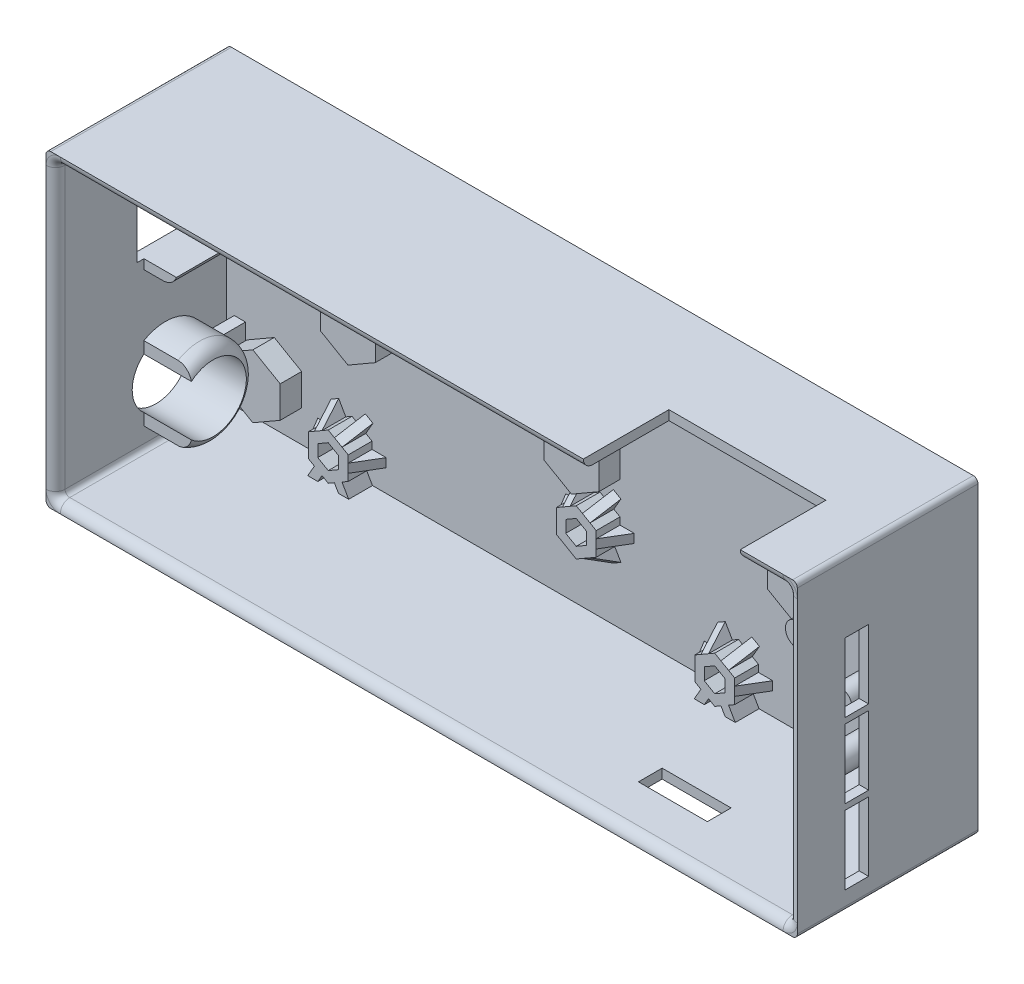
from build123d import *

# Parameters (mm, degrees)
ESBO_O1_W                   = 158
ESBO_O1_H                   = 65
RESSALTO_EXTRUS_O1_DEPTH    = 2
ESBO_O3_W                   = 158
ESBO_O3_H                   = 65
ESBO_O3_W_2                 = 154
ESBO_O3_H_2                 = 61
RESSALTO_EXTRUS_O2_DEPTH    = 32
ESBO_O9_W                   = 5
ESBO_O9_H                   = 14.5
CORTE_EXTRUS_O4_DEPTH       = 3
FILETE2_R                   = 1
ESBO_O28_W                  = 14.5
ESBO_O28_H                  = 5
CORTE_EXTRUS_O13_DEPTH      = 3
ESBO_O29_R                  = 2.5
RESSALTO_EXTRUS_O7_DEPTH    = 14
ESBO_O30_R                  = 7
ESBO_O30_W                  = 12
ESBO_O30_H                  = 14
CORTE_EXTRUS_O14_DEPTH      = 3
ESBO_O31_R                  = 9
ESBO_O31_R_2                = 7
RESSALTO_EXTRUS_O8_DEPTH    = 10
FILETE3_R                   = 3
ESBO_O32_W                  = 16
ESBO_O32_H                  = 18
ESBO_O32_W_2                = 12
ESBO_O32_H_2                = 14
RESSALTO_EXTRUS_O9_DEPTH    = 7
FILETE4_R                   = 3
ESBO_O33_W                  = 3
ESBO_O33_H                  = 14
CORTE_EXTRUS_O15_DEPTH      = 3
CORTE_EXTRUS_O16_DEPTH      = 47
CORTE_EXTRUS_O16_DEPTH_BACK = 3
ESBO_O34_W                  = 10
ESBO_O34_H                  = 3.5
CORTE_EXTRUS_O17_DEPTH      = 2
RESSALTO_EXTRUS_O10_DEPTH   = 4.5
CORTE_EXTRUS_O18_DEPTH      = 4.5
CORTE_EXTRUS_O18_DEPTH_BACK = 4.5
ESBO_O38_R                  = 3.987662124
ESBO_O38_R_2                = 4.299038484
ESBO_O38_R_3                = 4.020114398
ESBO_O38_R_4                = 3.841746328
ESBO_O38_R_5                = 4.701933519
ESBO_O38_R_6                = 4.523812843
ESBO_O38_R_7                = 4.213448947
RESSALTO_EXTRUS_O11_DEPTH   = 1
FILETE6_R                   = 0.5
RESSALTO_EXTRUS_O12_DEPTH   = 5
ESBO_O45_W                  = 3
ESBO_O45_H                  = 1.849742261
ESBO_O45_H_2                = 1.849742262
RESSALTO_EXTRUS_O13_DEPTH   = 5
CORTE_EXTRUS_O19_DEPTH      = 2
CORTE_EXTRUS_O20_DEPTH      = 2
CORTE_EXTRUS_O21_DEPTH      = 2
CORTE_EXTRUS_O22_DEPTH      = 2
CORTE_EXTRUS_O23_DEPTH      = 2
CORTE_EXTRUS_O24_DEPTH      = 2
CORTE_EXTRUS_O25_DEPTH      = 2
CORTE_EXTRUS_O26_DEPTH      = 2
CORTE_EXTRUS_O27_DEPTH      = 2
CORTE_EXTRUS_O28_DEPTH      = 2
CORTE_EXTRUS_O29_DEPTH      = 2
CORTE_EXTRUS_O30_DEPTH      = 2
CORTE_EXTRUS_O31_DEPTH      = 2
CORTE_EXTRUS_O32_DEPTH      = 1.9
CORTE_EXTRUS_O33_DEPTH      = 1.9
CORTE_EXTRUS_O34_DEPTH      = 1.9
CORTE_EXTRUS_O35_DEPTH      = 1.9
CORTE_EXTRUS_O36_DEPTH      = 1.9
CORTE_EXTRUS_O37_DEPTH      = 1.9
CORTE_EXTRUS_O38_DEPTH      = 1.9
CORTE_EXTRUS_O39_DEPTH      = 1.9
CORTE_EXTRUS_O40_DEPTH      = 1.9
CORTE_EXTRUS_O41_DEPTH      = 1.9
CORTE_EXTRUS_O42_DEPTH      = 1.9
CORTE_EXTRUS_O43_DEPTH      = 1.9
CORTE_EXTRUS_O44_DEPTH      = 1.9
RESSALTO_EXTRUS_O16_DEPTH   = 4
FILETE7_R                   = 2
ESBO_O78_W                  = 33
ESBO_O78_H                  = 18
CORTE_EXTRUS_O47_DEPTH      = 2
ESBO_O79_W                  = 1.267243041
ESBO_O79_H                  = 16.187236571
ESBO_O79_W_2                = 1.14769181
RESSALTO_EXTRUS_O17_DEPTH   = 4
ESBO_O80_W                  = 2.363247025
ESBO_O80_H                  = 10.146209854
RESSALTO_EXTRUS_O18_DEPTH   = 5.5


# Some blends are built 0.0001 mm under size
with BuildPart() as part:
    # Esboço1 → Ressalto-extrusão1 (new body)
    with BuildSketch(Plane.XY):
        with Locations((-79, 32.5)):
            Rectangle(ESBO_O1_W, ESBO_O1_H)
    extrude(amount=RESSALTO_EXTRUS_O1_DEPTH)

    # Esboço3 → Ressalto-extrusão2 (add)
    with BuildSketch(Plane.XY.offset(2)):
        with Locations((-79, 32.5)):
            Rectangle(ESBO_O3_W, ESBO_O3_H)
        with Locations((-79, 32.5)):
            Rectangle(ESBO_O3_W_2, ESBO_O3_H_2, mode=Mode.SUBTRACT)
    extrude(amount=RESSALTO_EXTRUS_O2_DEPTH)

    # Esboço9 → Corte-extrusão4 (cut)
    with BuildSketch(Plane(origin=(0, 0, 0), x_dir=(0, 0, -1), z_dir=(1, 0, 0))):
        with Locations((-25.5, 26.95)):
            Rectangle(ESBO_O9_W, ESBO_O9_H)
        with Locations((-25.5, 42.65)):
            Rectangle(ESBO_O9_W, ESBO_O9_H)
        with Locations((-25.5, 11.25)):
            Rectangle(ESBO_O9_W, ESBO_O9_H)
    extrude(amount=-CORTE_EXTRUS_O4_DEPTH, mode=Mode.SUBTRACT)

    # Filete2
    filete2_edges = [part.edges().sort_by_distance(p)[0] for p in [
        (-2, 63, 18),
        (-2, 2, 18),
        (-156, 2, 18),
        (-156, 63, 18),
        (0, 0, 17),
        (-158, 0, 17),
        (-158, 65, 17),
        (0, 65, 17),
    ]]
    fillet(filete2_edges, radius=FILETE2_R)

    # Esboço28 → Corte-extrusão13 (cut)
    with BuildSketch(Plane(origin=(0, 0, 0), x_dir=(-1, 0, 0), z_dir=(0, -1, 0))):
        with Locations((36.171903921, -25.5)):
            Rectangle(ESBO_O28_W, ESBO_O28_H)
    extrude(amount=-CORTE_EXTRUS_O13_DEPTH, mode=Mode.SUBTRACT)

    # Esboço29 → Ressalto-extrusão7 (add)
    with BuildSketch(Plane.XY.offset(2)):
        with Locations((-8, 57)):
            Circle(ESBO_O29_R)
        with Locations((-22, 33.5)):
            Circle(ESBO_O29_R)
        with Locations((-17.5, 11)):
            Circle(ESBO_O29_R)
        with Locations((-13, 26)):
            Circle(ESBO_O29_R)
        with Locations((-13, 41)):
            Circle(ESBO_O29_R)
    extrude(amount=RESSALTO_EXTRUS_O7_DEPTH)

    # Esboço30 → Corte-extrusão14 (cut)
    with BuildSketch(Plane.ZY.offset(158)):
        with Locations((14.870480003, 14.003310547)):
            Circle(ESBO_O30_R)
        with Locations((14.91, 43.700347018)):
            Rectangle(ESBO_O30_W, ESBO_O30_H)
    extrude(amount=-CORTE_EXTRUS_O14_DEPTH, mode=Mode.SUBTRACT)

    # Esboço31 → Ressalto-extrusão8 (add)
    with BuildSketch(Plane(origin=(-156, 0, 0), x_dir=(0, 0, -1), z_dir=(1, 0, 0))):
        with Locations(Location((-14.870480003, 14.003310547, 0), (0, 0, 180))):
            Circle(ESBO_O31_R)
        with Locations(Location((-14.870480003, 14.003310547, 0), (0, 0, 180))):
            Circle(ESBO_O31_R_2, mode=Mode.SUBTRACT)
    extrude(amount=RESSALTO_EXTRUS_O8_DEPTH)

    # Filete3
    # the kernel refuses this fillet: 3 mm, written as the material it takes off along each edge
    with BuildSketch(Plane(origin=(-146, 14.003310547, 14.870480003), x_dir=(0, 0, 1), z_dir=(0, 1, 0))) as filete3_piece_1:
        with BuildLine():
            CenterArc((6, -2.828427125), FILETE3_R, 0, 70.528779366)
            Line((7, 0), (7.02, 0.056568542))
            ThreePointArc((7.02, 0.056568542), (8, 0.06), (9, 0.06))
            Line((9, 0.06), (9.06, 0))
            Line((9.06, 0), (9.06, -2.828427125))
            Line((9.06, -2.828427125), (9, -2.828427125))
        make_face()
    revolve(axis=Axis((-146, 14.003310547, 14.870480003), (1, 0, 0)), mode=Mode.SUBTRACT)

    # Esboço32 → Ressalto-extrusão9 (add)
    with BuildSketch(Plane(origin=(-156, 0, 0), x_dir=(0, 0, -1), z_dir=(1, 0, 0))):
        with Locations((-14.91, 43.700347018)):
            Rectangle(ESBO_O32_W, ESBO_O32_H)
        with Locations((-14.91, 43.700347018)):
            Rectangle(ESBO_O32_W_2, ESBO_O32_H_2, mode=Mode.SUBTRACT)
    extrude(amount=RESSALTO_EXTRUS_O9_DEPTH)

    # Filete4
    # the kernel refuses this fillet: 3 mm, written as the material it takes off along each edge
    with BuildSketch(Plane(origin=(-149, 27.200347018, 6.91), x_dir=(0, 0, 1), z_dir=(0, 1, 0)), Plane(origin=(-149, 60.200347018, 22.91), x_dir=(0, 0, -1), z_dir=(0, -1, 0))) as filete4_piece_1:
        with BuildLine():
            CenterArc((FILETE4_R, -FILETE4_R), FILETE4_R, 90, 90)
            Line((0, -FILETE4_R), (0, 0))
            Line((0, 0), (FILETE4_R, 0))
        make_face()
    extrude(amount=33, mode=Mode.SUBTRACT)
    with BuildSketch(Plane(origin=(-149, 34.700347018, 30.41), x_dir=(0, 1, 0), z_dir=(0, 0, -1))) as filete4_piece_2_section:
        with BuildLine():
            CenterArc((FILETE4_R, -FILETE4_R), FILETE4_R, 90, 90)
            Line((0, -FILETE4_R), (0, 0))
            Line((0, 0), (FILETE4_R, 0))
        make_face()
    filete4_piece_2 = extrude(amount=31, mode=Mode.PRIVATE)
    filete4_piece_2 = split(filete4_piece_2, bisect_by=Plane(origin=(-149, 34.700347018, 2), z_dir=(0, 0, 1)), keep=Keep.TOP, mode=Mode.PRIVATE)
    add(filete4_piece_2, mode=Mode.SUBTRACT)
    with BuildSketch(Plane(origin=(-149, 52.700347018, -0.59), x_dir=(0, -1, 0), z_dir=(0, 0, 1))) as filete4_piece_3_section:
        with BuildLine():
            CenterArc((FILETE4_R, -FILETE4_R), FILETE4_R, 90, 90)
            Line((0, -FILETE4_R), (0, 0))
            Line((0, 0), (FILETE4_R, 0))
        make_face()
    filete4_piece_3 = extrude(amount=31, mode=Mode.PRIVATE)
    filete4_piece_3 = split(filete4_piece_3, bisect_by=Plane(origin=(-149, 52.700347018, 2), z_dir=(0, 0, 1)), keep=Keep.TOP, mode=Mode.PRIVATE)
    add(filete4_piece_3, mode=Mode.SUBTRACT)

    # Esboço33 → Corte-extrusão15 (cut)
    with BuildSketch(Plane(origin=(0, 0, 20.91), x_dir=(-1, 0, 0), z_dir=(0, 0, -1))):
        with Locations((150.671572875, 43.700347018)):
            Rectangle(ESBO_O33_W, ESBO_O33_H)
    extrude(amount=-CORTE_EXTRUS_O15_DEPTH, mode=Mode.SUBTRACT)

    # Esboço34 → Corte-extrusão16 (cut, two sides: drawn at the far end of the back side and taken through both)
    with BuildSketch(Plane.XZ.offset(-50.700347018).offset(-CORTE_EXTRUS_O16_DEPTH_BACK)):
        with Locations((-151, 21.16)):
            Rectangle(ESBO_O34_W, ESBO_O34_H)
    extrude(amount=CORTE_EXTRUS_O16_DEPTH + CORTE_EXTRUS_O16_DEPTH_BACK, mode=Mode.SUBTRACT)

    # Esboço35 → Corte-extrusão17 (cut)
    with BuildSketch(Plane(origin=(0, 0, 22.91), x_dir=(-1, 0, 0), z_dir=(0, 0, -1))):
        with BuildLine():
            Line((148.828427125, 9.957804619), (156, 9.957804619))
            Line((156, 9.957804619), (156, 18.048816476))
            Line((156, 18.048816476), (148.828427125, 18.048816476))
            add(Edge.make_bspline(
                [(148.828427125, 18.048816476), (148.721827144, 18.048816476), (148.617473443, 18.036268574), (148.412890024, 17.988135846), (148.311539299, 17.951862361), (148.025172375, 17.815144487), (147.852894626, 17.685148967), (147.408566467, 17.239032501), (147.197323117, 16.864378725), (146.964634039, 16.27710606), (146.900643282, 16.074532297), (146.795904993, 15.667894463), (146.754783321, 15.463001878), (146.658115832, 14.844588791), (146.628485083, 14.427442433), (146.628207302, 13.584897129), (146.657603619, 13.167368878), (146.753783178, 12.549007568), (146.794719575, 12.344171399), (146.898977131, 11.937737714), (146.96283246, 11.734810143), (147.117373485, 11.343295157), (147.207919423, 11.154063281), (147.425776621, 10.793671751), (147.554191951, 10.621822346), (147.850722242, 10.32321485), (148.023196697, 10.192743382), (148.309590824, 10.055529682), (148.411055092, 10.019022899), (148.616650565, 9.970441539), (148.721452308, 9.957804619), (148.828427125, 9.957804619)],
                knots=[0, 0, 0, 0, 0.03125, 0.03125, 0.0625, 0.0625, 0.125, 0.125, 0.25, 0.25, 0.3125, 0.3125, 0.375, 0.375, 0.5, 0.5, 0.625, 0.625, 0.6875, 0.6875, 0.75, 0.75, 0.8125, 0.8125, 0.875, 0.875, 0.9375, 0.9375, 0.96875, 0.96875, 1, 1, 1, 1], degree=3))
        make_face()
    extrude(amount=-CORTE_EXTRUS_O17_DEPTH, mode=Mode.SUBTRACT)


with BuildPart() as corte_extrus_o17_kept_piece:
    # of the separate pieces the step leaves, the one the design keeps (corte_extrus_o17_pieces_kept)
    add(part.part.solids().sort_by_distance((-157, 0, 34))[0])

    # Esboço36 → Ressalto-extrusão10 (add)
    # profile 1 of 7: a face of its own
    with BuildSketch(Plane.XY.offset(2)):
        Polygon((-151.75, 58.319764048), (-151.75, 51.680235952), (-146, 48.360471904), (-140.25, 51.680235952), (-140.25, 58.319764048), (-146, 61.639528096), align=None)
        Polygon((-148.75, 53.41228676), (-146, 51.824573519), (-143.25, 53.41228676), (-143.25, 56.58771324), (-146, 58.175426481), (-148.75, 56.58771324), align=None, mode=Mode.SUBTRACT)
    # profile 2 of 7: a face of its own
    with BuildSketch(Plane.XY.offset(2)):
        Polygon((-120.25, 29.180235952), (-120.25, 35.819764048), (-126, 39.139528096), (-131.75, 35.819764048), (-131.75, 29.180235952), (-126, 25.860471904), align=None)
        Polygon((-123.25, 34.08771324), (-126, 35.675426481), (-128.75, 34.08771324), (-128.75, 30.91228676), (-126, 29.324573519), (-123.25, 30.91228676), align=None, mode=Mode.SUBTRACT)
    # profile 3 of 7: a face of its own
    with BuildSketch(Plane.XY.offset(2)):
        Polygon((-140.25, 8.680235952), (-140.25, 15.319764048), (-146, 18.639528096), (-151.75, 15.319764048), (-151.75, 8.680235952), (-146, 5.360471904), align=None)
        Polygon((-143.25, 13.58771324), (-146, 15.175426481), (-148.75, 13.58771324), (-148.75, 10.41228676), (-146, 8.824573519), (-143.25, 10.41228676), align=None, mode=Mode.SUBTRACT)
    # profile 4 of 7: a face of its own
    with BuildSketch(Plane.XY.offset(2)):
        Polygon((-73.25, 29.180235952), (-73.25, 35.819764048), (-79, 39.139528096), (-84.75, 35.819764048), (-84.75, 29.180235952), (-79, 25.860471904), align=None)
        Polygon((-76.25, 34.08771324), (-79, 35.675426481), (-81.75, 34.08771324), (-81.75, 30.91228676), (-79, 29.324573519), (-76.25, 30.91228676), align=None, mode=Mode.SUBTRACT)
    # profile 5 of 7: a face of its own
    with BuildSketch(Plane.XY.offset(2)):
        Polygon((-26.25, 29.180235952), (-26.25, 35.819764048), (-32, 39.139528096), (-37.75, 35.819764048), (-37.75, 29.180235952), (-32, 25.860471904), align=None)
        Polygon((-29.25, 34.08771324), (-32, 35.675426481), (-34.75, 34.08771324), (-34.75, 30.91228676), (-32, 29.324573519), (-29.25, 30.91228676), align=None, mode=Mode.SUBTRACT)
    # profile 6 of 7: a face of its own
    with BuildSketch(Plane.XY.offset(2)):
        Polygon((-17.75, 56.319764048), (-17.75, 49.680235952), (-12, 46.360471904), (-6.25, 49.680235952), (-6.25, 56.319764048), (-12, 59.639528096), align=None)
        Polygon((-14.75, 51.41228676), (-12, 49.824573519), (-9.25, 51.41228676), (-9.25, 54.58771324), (-12, 56.175426481), (-14.75, 54.58771324), align=None, mode=Mode.SUBTRACT)
    # profile 7 of 7: a face of its own
    with BuildSketch(Plane.XY.offset(2)):
        Polygon((-6.25, 8.680235952), (-6.25, 15.319764048), (-12, 18.639528096), (-17.75, 15.319764048), (-17.75, 8.680235952), (-12, 5.360471904), align=None)
        Polygon((-9.25, 13.58771324), (-12, 15.175426481), (-14.75, 13.58771324), (-14.75, 10.41228676), (-12, 8.824573519), (-9.25, 10.41228676), align=None, mode=Mode.SUBTRACT)
    extrude(amount=RESSALTO_EXTRUS_O10_DEPTH)

    # Esboço37 → Corte-extrusão18 (cut, two sides: drawn at the far end of the back side and taken through both)
    with BuildSketch(Plane.XY.offset(2).offset(-CORTE_EXTRUS_O18_DEPTH_BACK)):
        Polygon((-29.249864749, 34.087938134), (-31.999864749, 35.675651375), (-34.749864749, 34.087938134), (-34.749864749, 30.912511654), (-31.999864749, 29.324798414), (-29.249864749, 30.912511654), align=None)
        Polygon((-123.25, 34.08771324), (-126, 35.675426481), (-128.75, 34.08771324), (-128.75, 30.91228676), (-126, 29.324573519), (-123.25, 30.91228676), align=None)
        Polygon((-148.75, 53.41228676), (-146, 51.824573519), (-143.25, 53.41228676), (-143.25, 56.58771324), (-146, 58.175426481), (-148.75, 56.58771324), align=None)
        Polygon((-143.25, 13.58771324), (-146, 15.175426481), (-148.75, 13.58771324), (-148.75, 10.41228676), (-146, 8.824573519), (-143.25, 10.41228676), align=None)
        Polygon((-76.25, 34.08771324), (-79, 35.675426481), (-81.75, 34.08771324), (-81.75, 30.91228676), (-79, 29.324573519), (-76.25, 30.91228676), align=None)
        Polygon((-14.75, 51.41228676), (-12, 49.824573519), (-9.25, 51.41228676), (-9.25, 54.58771324), (-12, 56.175426481), (-14.75, 54.58771324), align=None)
        Polygon((-9.249902839, 13.587659255), (-11.999902839, 15.175372496), (-14.749902839, 13.587659255), (-14.749902839, 10.412232775), (-11.999902839, 8.824519535), (-9.249902839, 10.412232775), align=None)
    extrude(amount=CORTE_EXTRUS_O18_DEPTH + CORTE_EXTRUS_O18_DEPTH_BACK, mode=Mode.SUBTRACT)

    # Esboço38 → Ressalto-extrusão11 (add)
    with BuildSketch(Plane.XY.offset(6.5)):
        with Locations((-79.176275835, 32.598510192)):
            Circle(ESBO_O38_R)
        with Locations((-126.155236386, 32.598510192)):
            Circle(ESBO_O38_R_2)
        with Locations((-145.998279379, 55.119394969)):
            Circle(ESBO_O38_R_3)
        with Locations((-145.998279379, 11.890437993)):
            Circle(ESBO_O38_R_4)
        with Locations((-11.958357515, 11.890437993)):
            Circle(ESBO_O38_R_5)
        with Locations((-31.837089943, 32.598510192)):
            Circle(ESBO_O38_R_6)
        with Locations((-11.958357515, 53.366898853)):
            Circle(ESBO_O38_R_7)
    extrude(amount=-RESSALTO_EXTRUS_O11_DEPTH)

    # Filete6
    # the kernel refuses this fillet: 0.5 mm, written as the material it adds along each edge
    with BuildSketch(Plane(origin=(-149.832531755, 54.03728676, 5.5), x_dir=(0, 0, -1), z_dir=(0.8660254037844398, -0.49999999999999795, 0)), Plane(origin=(-75.167468245, 33.46271324, 5.5), x_dir=(0, 0, -1), z_dir=(-0.8660254037844389, 0.49999999999999967, 0)), Plane(origin=(-142.167468245, 12.96271324, 5.5), x_dir=(0, 0, -1), z_dir=(-0.8660254037844387, 0.5, 0)), Plane(origin=(-122.167468245, 33.46271324, 5.5), x_dir=(0, 0, -1), z_dir=(-0.8660254037844347, 0.500000000000007, 0)), Plane(origin=(-8.167371085, 12.962659255, 5.5), x_dir=(0, 0, -1), z_dir=(-0.8660254037844384, 0.5000000000000004, 0)), Plane(origin=(-15.832531755, 52.03728676, 5.5), x_dir=(0, 0, -1), z_dir=(0.8660254037844389, -0.49999999999999967, 0)), Plane(origin=(-28.167332995, 33.462938134, 5.5), x_dir=(0, 0, -1), z_dir=(-0.8660254037844382, 0.5000000000000009, 0))) as filete6_piece_1:
        with BuildLine():
            CenterArc((FILETE6_R, FILETE6_R), FILETE6_R, 180, 90)
            Line((0, FILETE6_R), (0, 0))
            Line((0, 0), (FILETE6_R, 0))
        make_face()
    extrude(amount=5.675426481)
    with BuildSketch(Plane(origin=(-147.082531755, 51.199573519, 5.5), x_dir=(-0.4999999999999986, 0.8660254037844395, 0), z_dir=(0.8660254037844395, 0.4999999999999986, 0)), Plane(origin=(-143.25, 52.16228676, 5.5), x_dir=(-1, 0, 0), z_dir=(0, 1, 0)), Plane(origin=(-142.167468245, 55.96271324, 5.5), x_dir=(-0.5000000000000013, -0.8660254037844379, 0), z_dir=(-0.8660254037844379, 0.5000000000000013, 0)), Plane(origin=(-144.917468245, 58.800426481, 5.5), x_dir=(0.4999999999999991, -0.8660254037844392, 0), z_dir=(-0.8660254037844393, -0.49999999999999917, 0)), Plane(origin=(-148.75, 57.83771324, 5.5), x_dir=(1, 0, 0), z_dir=(0, -1, 0)), Plane(origin=(-77.917468245, 36.300426481, 5.5), x_dir=(0.49999999999999967, -0.8660254037844389, 0), z_dir=(-0.8660254037844389, -0.49999999999999967, 0)), Plane(origin=(-76.25, 29.66228676, 5.5), x_dir=(-1, 0, 0), z_dir=(0, 1, 0)), Plane(origin=(-80.082531755, 28.699573519, 5.5), x_dir=(-0.5000000000000023, 0.8660254037844374, 0), z_dir=(0.8660254037844374, 0.5000000000000022, 0)), Plane(origin=(-82.832531755, 31.53728676, 5.5), x_dir=(0.5000000000000013, 0.8660254037844379, 0), z_dir=(0.8660254037844379, -0.5000000000000013, 0)), Plane(origin=(-81.75, 35.33771324, 5.5), x_dir=(1, 0, 0), z_dir=(0, -1, 0)), Plane(origin=(-149.832531755, 11.03728676, 5.5), x_dir=(0.5000000000000079, 0.8660254037844342, 0), z_dir=(0.8660254037844342, -0.5000000000000079, 0)), Plane(origin=(-148.75, 14.83771324, 5.5), x_dir=(1, 0, 0), z_dir=(0, -1, 0)), Plane(origin=(-144.917468245, 15.800426481, 5.5), x_dir=(0.500000000000001, -0.8660254037844382, 0), z_dir=(-0.8660254037844382, -0.500000000000001, 0)), Plane(origin=(-143.25, 9.16228676, 5.5), x_dir=(-1, 0, 0), z_dir=(0, 1, 0)), Plane(origin=(-147.082531755, 8.199573519, 5.5), x_dir=(-0.4999999999999944, 0.8660254037844419, 0), z_dir=(0.8660254037844419, 0.49999999999999434, 0)), Plane(origin=(-129.832531755, 31.53728676, 5.5), x_dir=(0.5000000000000051, 0.8660254037844357, 0), z_dir=(0.8660254037844358, -0.5000000000000051, 0)), Plane(origin=(-127.082531755, 28.699573519, 5.5), x_dir=(-0.5000000000000044, 0.8660254037844362, 0), z_dir=(0.8660254037844362, 0.5000000000000043, 0)), Plane(origin=(-123.25, 29.66228676, 5.5), x_dir=(-1, 0, 0), z_dir=(0, 1, 0)), Plane(origin=(-128.75, 35.33771324, 5.5), x_dir=(1, 0, 0), z_dir=(0, -1, 0)), Plane(origin=(-124.917468245, 36.300426481, 5.5), x_dir=(0.4999999999999991, -0.8660254037844392, 0), z_dir=(-0.8660254037844393, -0.49999999999999917, 0)), Plane(origin=(-13.082434594, 8.199519535, 5.5), x_dir=(-0.4999999999999998, 0.8660254037844388, 0), z_dir=(0.8660254037844388, 0.4999999999999998, 0)), Plane(origin=(-15.832531755, 11.03728676, 5.5), x_dir=(0.4999999999999994, 0.866025403784439, 0), z_dir=(0.866025403784439, -0.49999999999999944, 0)), Plane(origin=(-9.249902839, 9.162232775, 5.5), x_dir=(-1, 0, 0), z_dir=(0, 1, 0)), Plane(origin=(-10.917468245, 15.800426481, 5.5), x_dir=(0.4999999999999999, -0.8660254037844387, 0), z_dir=(-0.8660254037844388, -0.49999999999999994, 0)), Plane(origin=(-14.75, 14.83771324, 5.5), x_dir=(1, 0, 0), z_dir=(0, -1, 0)), Plane(origin=(-13.082531755, 49.199573519, 5.5), x_dir=(-0.5000000000000001, 0.8660254037844386, 0), z_dir=(0.8660254037844386, 0.5000000000000001, 0)), Plane(origin=(-9.25, 50.16228676, 5.5), x_dir=(-1, 0, 0), z_dir=(0, 1, 0)), Plane(origin=(-8.167468245, 53.96271324, 5.5), x_dir=(-0.49999999999999895, -0.8660254037844393, 0), z_dir=(-0.8660254037844393, 0.49999999999999895, 0)), Plane(origin=(-14.75, 55.83771324, 5.5), x_dir=(1, 0, 0), z_dir=(0, -1, 0)), Plane(origin=(-10.917468245, 56.800426481, 5.5), x_dir=(0.49999999999999767, -0.86602540378444, 0), z_dir=(-0.86602540378444, -0.4999999999999977, 0)), Plane(origin=(-34.75, 35.33771324, 5.5), x_dir=(1, 0, 0), z_dir=(0, -1, 0)), Plane(origin=(-30.917332995, 36.300651375, 5.5), x_dir=(0.5000000000000009, -0.8660254037844382, 0), z_dir=(-0.8660254037844382, -0.5000000000000009, 0)), Plane(origin=(-29.249864749, 29.662511654, 5.5), x_dir=(-1, 0, 0), z_dir=(0, 1, 0)), Plane(origin=(-33.082531755, 28.699573519, 5.5), x_dir=(-0.4999999999999987, 0.8660254037844394, 0), z_dir=(0.8660254037844395, 0.4999999999999987, 0)), Plane(origin=(-35.832531755, 31.53728676, 5.5), x_dir=(0.499999999999999, 0.8660254037844393, 0), z_dir=(0.8660254037844393, -0.49999999999999895, 0))) as filete6_piece_2:
        with BuildLine():
            CenterArc((FILETE6_R, -FILETE6_R), FILETE6_R, 90, 90)
            Line((0, -FILETE6_R), (0, 0))
            Line((0, 0), (FILETE6_R, 0))
        make_face()
    extrude(amount=5.675426481)

    # Esboço44 → Ressalto-extrusão12 (add)
    # profile 1 of 5: a face of its own
    with BuildSketch(Plane.XY.offset(2)):
        Polygon((-129.646690539, 60.726280189), (-133.846690539, 58.301409058), (-133.846690539, 53.451666797), (-129.646690539, 51.026795666), (-125.446690539, 53.451666797), (-125.446690539, 58.301409058), align=None)
        Polygon((-129.646690539, 58.416879112), (-131.846690539, 57.14670852), (-131.846690539, 54.606367335), (-129.646690539, 53.336196743), (-127.446690539, 54.606367335), (-127.446690539, 57.14670852), align=None, mode=Mode.SUBTRACT)
    # profile 2 of 5: a face of its own
    with BuildSketch(Plane.XY.offset(2)):
        Polygon((-129.646690539, 12.466280189), (-133.846690539, 10.041409058), (-133.846690539, 5.191666797), (-129.646690539, 2.766795666), (-125.446690539, 5.191666797), (-125.446690539, 10.041409058), align=None)
        Polygon((-129.646690539, 10.156879112), (-131.846690539, 8.88670852), (-131.846690539, 6.346367335), (-129.646690539, 5.076196743), (-127.446690539, 6.346367335), (-127.446690539, 8.88670852), align=None, mode=Mode.SUBTRACT)
    # profile 3 of 5: a face of its own
    with BuildSketch(Plane.XY.offset(2)):
        Polygon((-77.491824846, 24.749742261), (-81.691824846, 22.324871131), (-81.691824846, 17.475128869), (-77.491824846, 15.050257739), (-73.291824846, 17.475128869), (-73.291824846, 22.324871131), align=None)
        Polygon((-77.491824846, 22.440341184), (-79.691824846, 21.170170592), (-79.691824846, 18.629829408), (-77.491824846, 17.359658816), (-75.291824846, 18.629829408), (-75.291824846, 21.170170592), align=None, mode=Mode.SUBTRACT)
    # profile 4 of 5: a face of its own
    with BuildSketch(Plane.XY.offset(2)):
        Polygon((-48.366690539, 12.466280189), (-52.566690539, 10.041409058), (-52.566690539, 5.191666797), (-48.366690539, 2.766795666), (-44.166690539, 5.191666797), (-44.166690539, 10.041409058), align=None)
        Polygon((-48.366690539, 10.156879112), (-50.566690539, 8.88670852), (-50.566690539, 6.346367335), (-48.366690539, 5.076196743), (-46.166690539, 6.346367335), (-46.166690539, 8.88670852), align=None, mode=Mode.SUBTRACT)
    # profile 5 of 5: a face of its own
    with BuildSketch(Plane.XY.offset(2)):
        Polygon((-53.446690539, 60.726280189), (-57.646690539, 58.301409058), (-57.646690539, 53.451666797), (-53.446690539, 51.026795666), (-49.246690539, 53.451666797), (-49.246690539, 58.301409058), align=None)
        Polygon((-53.446690539, 58.416879112), (-55.646690539, 57.14670852), (-55.646690539, 54.606367335), (-53.446690539, 53.336196743), (-51.246690539, 54.606367335), (-51.246690539, 57.14670852), align=None, mode=Mode.SUBTRACT)
    extrude(amount=RESSALTO_EXTRUS_O12_DEPTH)

    # Esboço45 → Ressalto-extrusão13 (add)
    with BuildSketch(Plane.XY.offset(2)):
        with Locations((-123.946690539, 55.876537928)):
            Rectangle(ESBO_O45_W, ESBO_O45_H)
        Polygon((-132.445728644, 62.5743564), (-130.945728644, 59.976280189), (-132.547652433, 59.051409058), (-134.047652433, 61.649485269), align=None)
        with Locations((-135.346690539, 55.876537928)):
            Rectangle(ESBO_O45_W, ESBO_O45_H)
        Polygon((-134.047652433, 50.103590585), (-132.547652433, 52.701666797), (-130.945728644, 51.776795666), (-132.445728644, 49.178719455), align=None)
        Polygon((-126.847652433, 49.178719455), (-128.347652433, 51.776795666), (-126.745728644, 52.701666797), (-125.245728644, 50.103590585), align=None)
        Polygon((-125.245728644, 61.649485269), (-126.847652433, 62.5743564), (-128.347652433, 59.976280189), (-126.745728644, 59.051409058), align=None)
        Polygon((-127.47975753, 2), (-128.353523045, 3.513406267), (-126.751599257, 4.438277397), (-125.343859145, 2), align=None)
        Polygon((-133.959748782, 1.992239999), (-132.546091779, 4.440765753), (-130.94416799, 3.515894622), (-131.819370159, 2), align=None)
        with Locations((-135.346690539, 7.607957041)):
            Rectangle(ESBO_O45_W, ESBO_O45_H)
        Polygon((-132.451599257, 14.310967), (-130.951599257, 11.712890789), (-132.553523045, 10.788019658), (-134.053523045, 13.38609587), align=None)
        Polygon((-125.24416799, 13.388584225), (-126.846091779, 14.313455356), (-128.346091779, 11.715379145), (-126.74416799, 10.790508014), align=None)
        with Locations((-123.946690539, 7.607957041)):
            Rectangle(ESBO_O45_W, ESBO_O45_H)
        with Locations((-71.791824846, 19.899872626)):
            Rectangle(ESBO_O45_W, ESBO_O45_H)
        Polygon((-73.09061855, 25.672806236), (-74.692542339, 26.597677367), (-76.192542339, 23.999601156), (-74.59061855, 23.074730025), align=None)
        Polygon((-80.290728859, 26.597895891), (-78.790728859, 23.99981968), (-80.392652648, 23.074948549), (-81.892652648, 25.67302476), align=None)
        with Locations((-83.191824846, 19.899872626)):
            Rectangle(ESBO_O45_W, ESBO_O45_H)
        Polygon((-81.892542339, 14.126911553), (-80.392542339, 16.724987764), (-78.79061855, 15.800116633), (-80.29061855, 13.202040422), align=None)
        Polygon((-74.692652648, 13.202258946), (-76.192652648, 15.800335157), (-74.590728859, 16.725206288), (-73.090728859, 14.127130076), align=None)
        with Locations((-42.666690539, 7.625326922)):
            Rectangle(ESBO_O45_W, ESBO_O45_H)
        Polygon((-43.964696875, 13.388889577), (-45.566620663, 14.313760707), (-47.066620663, 11.715684496), (-45.464696875, 10.790813365), align=None)
        Polygon((-51.157085382, 14.31934659), (-49.657085382, 11.721270378), (-51.259009171, 10.796399248), (-52.759009171, 13.394475459), align=None)
        with Locations((-54.066690539, 7.625326922)):
            Rectangle(ESBO_O45_W, ESBO_O45_H)
        Polygon((-52.680453961, 1.992239999), (-51.266620663, 4.441071104), (-49.664696875, 3.516199974), (-50.540075337, 2), align=None)
        Polygon((-46.180405697, 2), (-47.059009171, 3.521785856), (-45.457085382, 4.446656987), (-44.044507312, 2), align=None)
        Polygon((-49.045419826, 61.649306973), (-49.602599669, 61.970994905), (-50.995591597, 61.970994905), (-52.147343615, 59.976101892), (-50.545419826, 59.051230762), align=None)
        Polygon((-55.897172755, 61.970994905), (-54.745574918, 59.976368943), (-56.347498707, 59.051497812), (-57.847498707, 61.649574023), (-57.290781408, 61.970994905), align=None)
        with Locations((-59.146690539, 55.876358843)):
            Rectangle(ESBO_O45_W, ESBO_O45_H_2)
        Polygon((-57.847343615, 50.103412289), (-56.347343615, 52.701488501), (-54.745419826, 51.77661737), (-56.245419826, 49.178541159), align=None)
        Polygon((-50.647498707, 49.178808209), (-52.147498707, 51.77688442), (-50.545574918, 52.701755551), (-49.045574918, 50.103679339), align=None)
        with Locations((-47.746690539, 55.876358843)):
            Rectangle(ESBO_O45_W, ESBO_O45_H_2)
    extrude(amount=RESSALTO_EXTRUS_O13_DEPTH)

    # Esboço47 → Corte-extrusão19 (cut)
    with BuildSketch(Plane.XZ.offset(-54.951666797)):
        Polygon((-125.446690539, 7), (-122.446690539, 2), (-122.446690539, 7), align=None)
    extrude(amount=-CORTE_EXTRUS_O19_DEPTH, mode=Mode.SUBTRACT)

    # Esboço48 → Corte-extrusão20 (cut)
    with BuildSketch(Plane(origin=(-73.840729138, -42.631964845, 0), x_dir=(0, 0, 1), z_dir=(-0.8660254037844383, -0.5000000000000007, 0))):
        Polygon((7, 109.01384659), (2, 106.01384659), (7, 106.01384659), align=None)
    extrude(amount=-CORTE_EXTRUS_O20_DEPTH, mode=Mode.SUBTRACT)

    # Esboço49 → Corte-extrusão21 (cut)
    with BuildSketch(Plane(origin=(-120.62930667, 69.645362678, 0), x_dir=(0, 0, -1), z_dir=(0.866025403784437, -0.5000000000000028, 0))):
        Polygon((-7, -20.632843949), (-2, -23.632843949), (-7, -23.632843949), align=None)
    extrude(amount=-CORTE_EXTRUS_O21_DEPTH, mode=Mode.SUBTRACT)

    # Esboço50 → Corte-extrusão22 (cut)
    with BuildSketch(Plane.XZ.offset(-54.951666797)):
        Polygon((-133.846690539, 7), (-136.846690539, 2), (-136.846690539, 7), align=None)
    extrude(amount=-CORTE_EXTRUS_O22_DEPTH, mode=Mode.SUBTRACT)

    # Esboço51 → Corte-extrusão23 (cut)
    with BuildSketch(Plane(origin=(-73.840729138, -42.631964845, 0), x_dir=(0, 0, 1), z_dir=(-0.8660254037844383, -0.5000000000000007, 0))):
        Polygon((7, 117.41384659), (2, 120.41384659), (7, 120.41384659), align=None)
    extrude(amount=-CORTE_EXTRUS_O23_DEPTH, mode=Mode.SUBTRACT)

    # Esboço52 → Corte-extrusão24 (cut)
    with BuildSketch(Plane(origin=(-120.62930667, 69.645362678, 0), x_dir=(0, 0, -1), z_dir=(0.8660254037844383, -0.5000000000000007, 0))):
        Polygon((-7, -12.195323525), (-2, -9.232843949), (-7, -9.232843949), align=None)
    extrude(amount=-CORTE_EXTRUS_O24_DEPTH, mode=Mode.SUBTRACT)

    # Esboço53 → Corte-extrusão25 (cut)
    with BuildSketch(Plane.XZ.offset(-54.951487712)):
        Polygon((-49.246690539, 7), (-46.246690539, 2), (-46.246690539, 7), align=None)
    extrude(amount=-CORTE_EXTRUS_O25_DEPTH, mode=Mode.SUBTRACT)

    # Esboço54 → Corte-extrusão26 (cut)
    with BuildSketch(Plane(origin=(-16.690575412, -9.636308207, 0), x_dir=(0, 0, 1), z_dir=(-0.8660254037844374, -0.5000000000000022, 0))):
        Polygon((7, 70.91384659), (2, 67.91384659), (7, 67.91384659), align=None)
    extrude(amount=-CORTE_EXTRUS_O26_DEPTH, mode=Mode.SUBTRACT)

    # Esboço55 → Corte-extrusão27 (cut)
    with BuildSketch(Plane.XZ.offset(-54.951487712)):
        Polygon((-57.646690539, 7), (-60.646690539, 2), (-60.646690539, 7), align=None)
    extrude(amount=-CORTE_EXTRUS_O27_DEPTH, mode=Mode.SUBTRACT)

    # Esboço56 → Corte-extrusão28 (cut)
    with BuildSketch(Plane(origin=(-16.690575412, -9.636308207, 0), x_dir=(0, 0, 1), z_dir=(-0.8660254037844383, -0.5000000000000007, 0))):
        Polygon((7, 79.31384659), (2, 82.31384659), (7, 82.31384659), align=None)
    extrude(amount=-CORTE_EXTRUS_O28_DEPTH, mode=Mode.SUBTRACT)

    # Esboço57 → Corte-extrusão29 (cut)
    with BuildSketch(Plane(origin=(-63.478997852, 36.649616498, 0), x_dir=(0, 0, -1), z_dir=(0.8660254037844374, -0.5000000000000024, 0))):
        Polygon((-7, 25.867156051), (-2, 28.867156051), (-7, 28.867156051), align=None)
    extrude(amount=-CORTE_EXTRUS_O29_DEPTH, mode=Mode.SUBTRACT)

    # Esboço58 → Corte-extrusão30 (cut)
    with BuildSketch(Plane(origin=(-63.478997852, 36.649616498, 0), x_dir=(0, 0, -1), z_dir=(0.86602540378444, -0.49999999999999784, 0))):
        Polygon((-7, 17.467156051), (-2, 14.467156051), (-7, 14.467156051), align=None)
    extrude(amount=-CORTE_EXTRUS_O30_DEPTH, mode=Mode.SUBTRACT)

    # Esboço59 → Corte-extrusão31 (cut)
    with BuildSketch(Plane(origin=(-65.934615106, 38.06736778, 0), x_dir=(0, 0, -1), z_dir=(0.8660254037844383, -0.5000000000000007, 0))):
        Polygon((-7, -17.312006888), (-2, -14.312006888), (-7, -14.312006888), align=None)
    extrude(amount=-CORTE_EXTRUS_O31_DEPTH, mode=Mode.SUBTRACT)

    # Esboço61 → Corte-extrusão32 (cut)
    with BuildSketch(Plane(origin=(-50.302743669, -29.042302598, 0), x_dir=(0, 0, 1), z_dir=(-0.8660254037844383, -0.5000000000000007, 0))):
        Polygon((7, 60.179817958), (2, 63.179817958), (7, 63.179817958), align=None)
    extrude(amount=-CORTE_EXTRUS_O32_DEPTH, mode=Mode.SUBTRACT)

    # Esboço62 → Corte-extrusão33 (cut)
    with BuildSketch(Plane(origin=(0, 20.824743756, 0), x_dir=(1, 0, 0), z_dir=(0, 1, 0))):
        Polygon((-81.691824846, -7), (-84.691824846, -7), (-84.691824846, -2), align=None)
    extrude(amount=-CORTE_EXTRUS_O33_DEPTH, mode=Mode.SUBTRACT)

    # Esboço63 → Corte-extrusão34 (cut)
    with BuildSketch(Plane(origin=(0, 20.824743756, 0), x_dir=(1, 0, 0), z_dir=(0, 1, 0))):
        Polygon((-73.291824846, -7), (-70.291824846, -2), (-70.291824846, -7), align=None)
    extrude(amount=-CORTE_EXTRUS_O34_DEPTH, mode=Mode.SUBTRACT)

    # Esboço64 → Corte-extrusão35 (cut)
    with BuildSketch(Plane(origin=(-48.70081988, -28.117431468, 0), x_dir=(0, 0, -1), z_dir=(0.8660254037844383, 0.5000000000000007, 0))):
        Polygon((-7, 51.779817958), (-2, 48.779817958), (-7, 48.779817958), align=None)
    extrude(amount=-CORTE_EXTRUS_O35_DEPTH, mode=Mode.SUBTRACT)

    # Esboço65 → Corte-extrusão36 (cut)
    with BuildSketch(Plane(origin=(-65.934615106, 38.06736778, 0), x_dir=(0, 0, -1), z_dir=(0.8660254037844386, -0.5, 0))):
        Polygon((-7, -25.712006888), (-2, -28.712006888), (-7, -28.712006888), align=None)
    extrude(amount=-CORTE_EXTRUS_O36_DEPTH, mode=Mode.SUBTRACT)

    # Esboço66 → Corte-extrusão37 (cut)
    with BuildSketch(Plane(origin=(-99.730553023, 57.579461634, 0), x_dir=(0, 0, -1), z_dir=(0.8660254037844385, -0.5000000000000004, 0))):
        Polygon((-7, -54.027229935), (-2, -51.027229935), (-7, -51.027229935), align=None)
    extrude(amount=-CORTE_EXTRUS_O37_DEPTH, mode=Mode.SUBTRACT)

    # Esboço67 → Corte-extrusão38 (cut)
    with BuildSketch(Plane(origin=(-93.141868955, -53.775483114, 0), x_dir=(0, 0, -1), z_dir=(0.8660254037844382, 0.5000000000000009, 0))):
        Polygon((-7, 75.619460603), (-2, 78.619460603), (-7, 78.619460603), align=None)
    extrude(amount=-CORTE_EXTRUS_O38_DEPTH, mode=Mode.SUBTRACT)

    # Esboço68 → Corte-extrusão39 (cut)
    with BuildSketch(Plane(origin=(0, 8.532828171, 0), x_dir=(1, 0, 0), z_dir=(0, 1, 0))):
        Polygon((-125.446690539, -7), (-122.446690539, -2), (-122.446690539, -7), align=None)
    extrude(amount=-CORTE_EXTRUS_O39_DEPTH, mode=Mode.SUBTRACT)

    # Esboço69 → Corte-extrusão40 (cut)
    with BuildSketch(Plane(origin=(0, 8.532828171, 0), x_dir=(1, 0, 0), z_dir=(0, 1, 0))):
        Polygon((-133.846690539, -7), (-136.846690539, -2), (-136.846690539, -7), align=None)
    extrude(amount=-CORTE_EXTRUS_O40_DEPTH, mode=Mode.SUBTRACT)

    # Esboço70 → Corte-extrusão41 (cut)
    with BuildSketch(Plane(origin=(-32.16735508, -18.571831115, 0), x_dir=(0, 0, -1), z_dir=(0.8660254037844386, 0.5, 0))):
        Polygon((-7, 34.979460603), (-2, 37.979460603), (-7, 37.979460603), align=None)
    extrude(amount=-CORTE_EXTRUS_O41_DEPTH, mode=Mode.SUBTRACT)

    # Esboço71 → Corte-extrusão42 (cut)
    with BuildSketch(Plane(origin=(0, 8.550198052, 0), x_dir=(1, 0, 0), z_dir=(0, 1, 0))):
        Polygon((-44.166690539, -7), (-41.166690539, -2), (-41.166690539, -7), align=None)
    extrude(amount=-CORTE_EXTRUS_O42_DEPTH, mode=Mode.SUBTRACT)

    # Esboço72 → Corte-extrusão43 (cut)
    with BuildSketch(Plane(origin=(-40.373005695, 23.309365706, 0), x_dir=(0, 0, 1), z_dir=(-0.8660254037844394, 0.4999999999999988, 0))):
        Polygon((7, -13.387229935), (2, -10.387229935), (7, -10.387229935), align=None)
    extrude(amount=-CORTE_EXTRUS_O43_DEPTH, mode=Mode.SUBTRACT)

    # Esboço73 → Corte-extrusão44 (cut)
    with BuildSketch(Plane(origin=(0, 8.550198052, 0), x_dir=(1, 0, 0), z_dir=(0, 1, 0))):
        Polygon((-52.566690539, -7), (-55.566690539, -2), (-55.566690539, -7), align=None)
    extrude(amount=-CORTE_EXTRUS_O44_DEPTH, mode=Mode.SUBTRACT)

    # Esboço77 → Ressalto-extrusão16 (add)
    with BuildSketch(Plane.XY.offset(34)):
        with BuildLine():
            ThreePointArc((-157, 65), (-157.707106781, 64.707106781), (-158, 64))
            Line((-158, 64), (-158, 1))
            ThreePointArc((-158, 1), (-157.707106781, 0.292893219), (-157, 0))
            Line((-157, 0), (-1, 0))
            ThreePointArc((-1, 0), (-0.292893219, 0.292893219), (0, 1))
            Line((0, 1), (0, 64))
            ThreePointArc((0, 64), (-0.292893219, 64.707106781), (-1, 65))
            Line((-1, 65), (-157, 65))
        make_face()
        with BuildLine():
            ThreePointArc((-156, 62), (-155.707106781, 62.707106781), (-155, 63))
            Line((-155, 63), (-3, 63))
            ThreePointArc((-3, 63), (-2.292893219, 62.707106781), (-2, 62))
            Line((-2, 62), (-2, 3))
            ThreePointArc((-2, 3), (-2.292893219, 2.292893219), (-3, 2))
            Line((-3, 2), (-155, 2))
            ThreePointArc((-155, 2), (-155.707106781, 2.292893219), (-156, 3))
            Line((-156, 3), (-156, 62))
        make_face(mode=Mode.SUBTRACT)
    extrude(amount=RESSALTO_EXTRUS_O16_DEPTH)

    # Filete7
    filete7_edges = [corte_extrus_o17_kept_piece.edges().sort_by_distance(p)[0] for p in [
        (-155.707106781, 62.707106781, 38),
        (-79, 63, 38),
        (-2.292893219, 62.707106781, 38),
        (-2, 32.5, 38),
        (-2.292893219, 2.292893219, 38),
        (-79, 2, 38),
        (-155.707106781, 2.292893219, 38),
        (-156, 32.5, 38),
    ]]
    fillet(filete7_edges, radius=FILETE7_R - 0.0001)  # a hair under: the kernel refuses the full size

    # Esboço78 → Corte-extrusão47 (cut)
    with BuildSketch(Plane(origin=(0, 65, 0), x_dir=(1, 0, 0), z_dir=(0, 1, 0))):
        with Locations((-28.5, -29)):
            Rectangle(ESBO_O78_W, ESBO_O78_H)
    extrude(amount=-CORTE_EXTRUS_O47_DEPTH, mode=Mode.SUBTRACT)

    # Esboço79 → Ressalto-extrusão17 (add)
    with BuildSketch(Plane.XY.offset(2)):
        with Locations((-154.391123816, 43.818940571)):
            Rectangle(ESBO_O79_W, ESBO_O79_H)
        with Locations((-152.059874826, 43.818940571)):
            Rectangle(ESBO_O79_W_2, ESBO_O79_H)
    extrude(amount=RESSALTO_EXTRUS_O17_DEPTH)

    # Esboço80 → Ressalto-extrusão18 (add)
    with BuildSketch(Plane.XY.offset(2)):
        with Locations((-153.227146656, 13.364308992)):
            Rectangle(ESBO_O80_W, ESBO_O80_H)
    extrude(amount=RESSALTO_EXTRUS_O18_DEPTH)


solid = corte_extrus_o17_kept_piece.part
